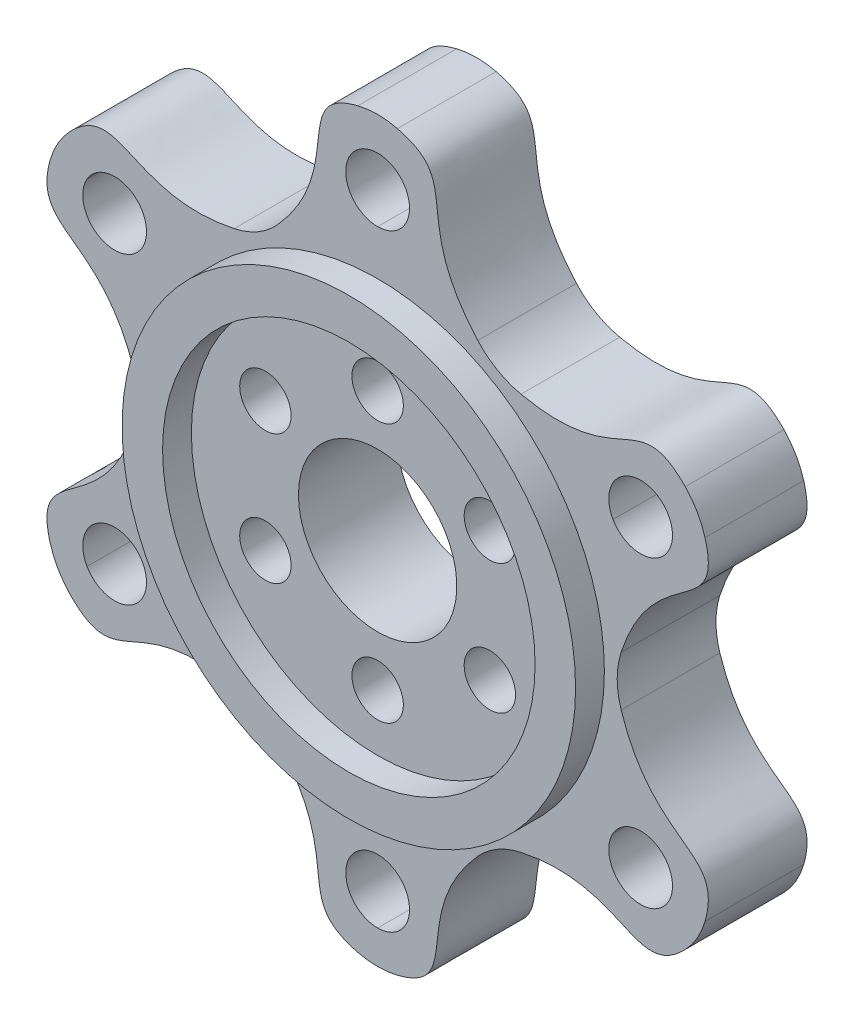
from build123d import *

# Parameters (mm, degrees)
SKETCH1_R           = 45.72
SKETCH1_R_2         = 9.779
SKETCH1_R_3         = 3.175
SKETCH1_R_4         = 3.937
BOSS_EXTRUDE3_DEPTH = 12.192
CUT_EXTRUDE1_START  = -22.86
CUT_EXTRUDE1_DEPTH  = 22.86
SKETCH4_R           = 28
SKETCH4_R_2         = 23
BOSS_EXTRUDE4_DEPTH = 3.556
FILLET1_R           = 10


with BuildPart() as part:
    # Sketch1 → Boss-Extrude3 (new body)
    with BuildSketch(Plane.XY):
        Circle(SKETCH1_R)
        Circle(SKETCH1_R_2, mode=Mode.SUBTRACT)
        with Locations((0, 16.002)):
            Circle(SKETCH1_R_3, mode=Mode.SUBTRACT)
        with Locations((13.858138511, 8.001)):
            Circle(SKETCH1_R_3, mode=Mode.SUBTRACT)
        with Locations((13.858138511, -8.001)):
            Circle(SKETCH1_R_3, mode=Mode.SUBTRACT)
        with Locations((0, -16.002)):
            Circle(SKETCH1_R_3, mode=Mode.SUBTRACT)
        with Locations((-13.858138511, -8.001)):
            Circle(SKETCH1_R_3, mode=Mode.SUBTRACT)
        with Locations((-13.858138511, 8.001)):
            Circle(SKETCH1_R_3, mode=Mode.SUBTRACT)
        with Locations((0, 37.5)):
            Circle(SKETCH1_R_4, mode=Mode.SUBTRACT)
        with Locations((32.475952642, 18.75)):
            Circle(SKETCH1_R_4, mode=Mode.SUBTRACT)
        with Locations((32.475952642, -18.75)):
            Circle(SKETCH1_R_4, mode=Mode.SUBTRACT)
        with Locations((0, -37.5)):
            Circle(SKETCH1_R_4, mode=Mode.SUBTRACT)
        with Locations((-32.475952642, -18.75)):
            Circle(SKETCH1_R_4, mode=Mode.SUBTRACT)
        with Locations((-32.475952642, 18.75)):
            Circle(SKETCH1_R_4, mode=Mode.SUBTRACT)
    extrude(amount=BOSS_EXTRUDE3_DEPTH)

    # Sketch2 → Cut-Extrude1 (cut)
    with BuildSketch(Plane.XY.offset(12.192).offset(CUT_EXTRUDE1_START)):
        with BuildLine():
            ThreePointArc((39.594681461, -22.86), (45.72, 0), (39.594681461, 22.86))
            add(Edge.make_bspline(
                [(29.25, 0), (32.932092251, 17.195322725), (44.628878831, 10.61767176), (39.594681461, 22.86)],
                knots=[0, 0, 0, 0, 1, 1, 1, 1], degree=3))
            add(Edge.make_bspline(
                [(29.25, 0), (32.932092251, -17.195322725), (44.628878831, -10.61767176), (39.594681461, -22.86)],
                knots=[0, 0, 0, 0, 1, 1, 1, 1], degree=3))
        make_face()
        with BuildLine():
            add(Edge.make_bspline(
                [(14.625, 25.331243061), (31.357632431, 19.922367126), (31.509612889, 33.34090693), (39.594681461, 22.86)],
                knots=[0, 0, 0, 0, 1, 1, 1, 1], degree=3))
            ThreePointArc((39.594681461, 22.86), (22.86, 39.594681461), (0, 45.72))
            add(Edge.make_bspline(
                [(14.625, 25.331243061), (1.574459819, 37.117689851), (13.119265943, 43.95857869), (0, 45.72)],
                knots=[0, 0, 0, 0, 1, 1, 1, 1], degree=3))
        make_face()
        with BuildLine():
            ThreePointArc((0, -45.72), (22.86, -39.594681461), (39.594681461, -22.86))
            add(Edge.make_bspline(
                [(14.625, -25.331243061), (31.357632431, -19.922367126), (31.509612889, -33.34090693), (39.594681461, -22.86)],
                knots=[0, 0, 0, 0, 1, 1, 1, 1], degree=3))
            add(Edge.make_bspline(
                [(14.625, -25.331243061), (1.574459819, -37.117689851), (13.119265943, -43.95857869), (0, -45.72)],
                knots=[0, 0, 0, 0, 1, 1, 1, 1], degree=3))
        make_face()
        with BuildLine():
            add(Edge.make_bspline(
                [(-14.625, 25.331243061), (-1.574459819, 37.117689851), (-13.119265943, 43.95857869), (0, 45.72)],
                knots=[0, 0, 0, 0, 1, 1, 1, 1], degree=3))
            ThreePointArc((0, 45.72), (-22.86, 39.594681461), (-39.594681461, 22.86))
            add(Edge.make_bspline(
                [(-14.625, 25.331243061), (-31.357632431, 19.922367126), (-31.509612889, 33.34090693), (-39.594681461, 22.86)],
                knots=[0, 0, 0, 0, 1, 1, 1, 1], degree=3))
        make_face()
        with BuildLine():
            ThreePointArc((-39.594681461, -22.86), (-22.86, -39.594681461), (0, -45.72))
            add(Edge.make_bspline(
                [(-14.625, -25.331243061), (-1.574459819, -37.117689851), (-13.119265943, -43.95857869), (0, -45.72)],
                knots=[0, 0, 0, 0, 1, 1, 1, 1], degree=3))
            add(Edge.make_bspline(
                [(-14.625, -25.331243061), (-31.357632431, -19.922367126), (-31.509612889, -33.34090693), (-39.594681461, -22.86)],
                knots=[0, 0, 0, 0, 1, 1, 1, 1], degree=3))
        make_face()
        with BuildLine():
            add(Edge.make_bspline(
                [(-29.25, 0), (-32.932092251, 17.195322725), (-44.628878831, 10.61767176), (-39.594681461, 22.86)],
                knots=[0, 0, 0, 0, 1, 1, 1, 1], degree=3))
            ThreePointArc((-39.594681461, 22.86), (-45.72, 0), (-39.594681461, -22.86))
            add(Edge.make_bspline(
                [(-29.25, 0), (-32.932092251, -17.195322725), (-44.628878831, -10.61767176), (-39.594681461, -22.86)],
                knots=[0, 0, 0, 0, 1, 1, 1, 1], degree=3))
        make_face()
    extrude(amount=CUT_EXTRUDE1_DEPTH, mode=Mode.SUBTRACT)

    # Sketch4 → Boss-Extrude4 (add)
    with BuildSketch(Plane.XY.offset(12.192)):
        Circle(SKETCH4_R)
        Circle(SKETCH4_R_2, mode=Mode.SUBTRACT)
    extrude(amount=BOSS_EXTRUDE4_DEPTH)

    # Fillet1
    fillet1_edges = [part.edges().sort_by_distance(p)[0] for p in [
        (29.25, 0, 6.096),
        (39.594681461, -22.86, 6.096),
        (0, -45.72, 6.096),
        (14.625, -25.331243061, 6.096),
        (-14.625, -25.331243061, 6.096),
        (-39.594681461, -22.86, 6.096),
        (-29.25, 0, 6.096),
        (-39.594681461, 22.86, 6.096),
        (-14.625, 25.331243061, 6.096),
        (14.625, 25.331243061, 6.096),
        (39.594681461, 22.86, 6.096),
        (0, 45.72, 6.096),
    ]]
    fillet(fillet1_edges, radius=FILLET1_R)


solid = part.part
